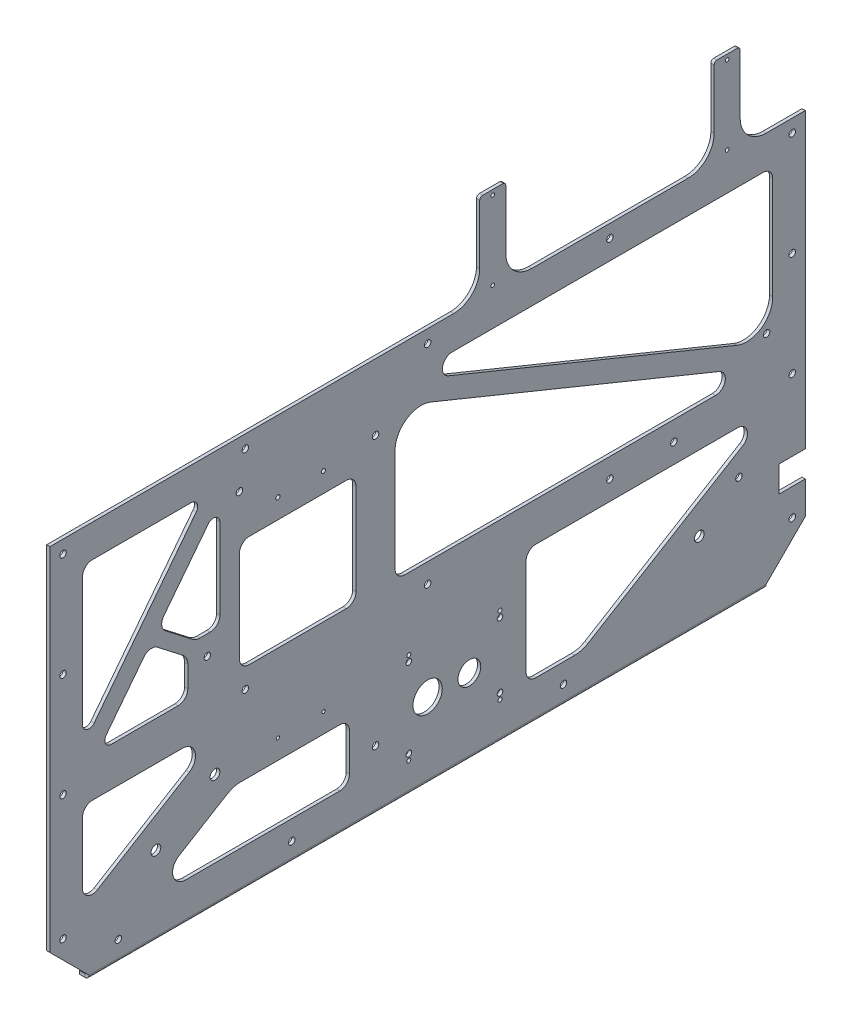
from build123d import *

# Parameters (mm, degrees)
BASE_FLANGE1_DEPTH = 3.175
SKETCH11_W         = 25.4
SKETCH11_H         = 85.725
TAB1_DEPTH         = 3.175
SKETCH6_R          = 4.7625
SKETCH6_R_2        = 14.2875
SKETCH6_R_3        = 3.175
CUT_EXTRUDE1_DEPTH = 595.54789231
SKETCH7_R          = 3.175
SKETCH7_R_2        = 2.032
SKETCH7_R_3        = 1.5875
SKETCH7_R_4        = 1.7859375
SKETCH7_W          = 25.4
SKETCH7_H          = 25.4
CUT_EXTRUDE2_DEPTH = 595.54789231
SKETCH8_R          = 2.726079357
SKETCH8_R_2        = 11.1125
SKETCH8_R_3        = 1.951379357
CUT_EXTRUDE3_DEPTH = 595.54789231
SKETCH9_R          = 4.7625
CUT_EXTRUDE4_DEPTH = 595.54789231
SKETCH10_R         = 3.175
CUT_EXTRUDE5_DEPTH = 595.54789231
FILLET2_R          = 2.794
FILLET3_R          = 25.4
CUT_EXTRUDE6_DEPTH = 595.54789231
CUT_EXTRUDE7_DEPTH = 595.54789231
EDGE_FLANGE1_DEPTH = 660.4


# Sheet-metal steps are written as plain solids
with BuildPart() as part:
    # Sketch1 → Base-Flange1 (new body)
    with BuildSketch(Plane(origin=(0, 0, 0), x_dir=(0, 0, -1), z_dir=(1, 0, 0))):
        Polygon((330.2, 0), (-330.2, 0), (-368.3, 38.1), (-368.3, 381), (368.3, 381), (368.3, 38.1), align=None)
    extrude(amount=-BASE_FLANGE1_DEPTH)

    # Sketch11 → Tab1 (add)
    with BuildSketch(Plane(origin=(0, 0, 0), x_dir=(0, 0, -1), z_dir=(1, 0, 0))):
        with Locations((292.1, 423.8625)):
            Rectangle(SKETCH11_W, SKETCH11_H)
        with Locations((63.5, 423.8625)):
            Rectangle(SKETCH11_W, SKETCH11_H)
    extrude(amount=-TAB1_DEPTH)

    # Sketch6 → Cut-Extrude1 (cut, through all)
    with BuildSketch(Plane(origin=(0, 0, 0), x_dir=(0, 0, -1), z_dir=(1, 0, 0))):
        with Locations((264.979179141, 73.025)):
            Circle(SKETCH6_R)
        with Locations((0, 69.85)):
            Circle(SKETCH6_R_2)
        with Locations((-264.979179141, 73.025)):
            Circle(SKETCH6_R)
        with Locations((132.489589571, 14.2875)):
            Circle(SKETCH6_R_3)
        with Locations((-132.489589571, 14.2875)):
            Circle(SKETCH6_R_3)
    extrude(amount=-CUT_EXTRUDE1_DEPTH, mode=Mode.SUBTRACT)

    # Sketch7 → Cut-Extrude2 (cut, through all)
    with BuildSketch(Plane(origin=(0, 0, 0), x_dir=(0, 0, -1), z_dir=(1, 0, 0))):
        with Locations((-355.6, 43.360512242)):
            Circle(SKETCH7_R)
        with Locations((-355.6, 165.1)):
            Circle(SKETCH7_R)
        with Locations((-177.8, 165.1)):
            Circle(SKETCH7_R)
        with Locations((0, 165.1)):
            Circle(SKETCH7_R)
        with Locations((177.8, 165.1)):
            Circle(SKETCH7_R)
        with Locations((355.6, 43.360512242)):
            Circle(SKETCH7_R)
        with Locations((355.6, 165.1)):
            Circle(SKETCH7_R)
        with Locations((-214.833393668, 211.619209216)):
            Circle(SKETCH7_R)
        with Locations((-301.625, 15.875)):
            Circle(SKETCH7_R)
        with Locations((-146.05, 311.4675)):
            Circle(SKETCH7_R_2)
        with Locations((-101.6, 311.4675)):
            Circle(SKETCH7_R_2)
        with Locations((303.625, 103.575)):
            Circle(SKETCH7_R)
        with Locations((-101.6, 108.2675)):
            Circle(SKETCH7_R_3)
        with Locations((-146.05, 108.2675)):
            Circle(SKETCH7_R_3)
        with Locations((240.125, 165.10000014)):
            Circle(SKETCH7_R)
        with Locations((330.6125, 211.525)):
            Circle(SKETCH7_R)
        with Locations((-355.6, 368.3)):
            Circle(SKETCH7_R)
        with Locations((-177.8, 368.3)):
            Circle(SKETCH7_R)
        with Locations((0, 368.3)):
            Circle(SKETCH7_R)
        with Locations((177.8, 368.3)):
            Circle(SKETCH7_R)
        with Locations((355.6, 368.3)):
            Circle(SKETCH7_R)
        with Locations((-50.8, 316.23)):
            Circle(SKETCH7_R)
        with Locations((-50.8, 53.975)):
            Circle(SKETCH7_R)
        with Locations((-355.6, 266.7)):
            Circle(SKETCH7_R)
        with Locations((355.6, 266.7)):
            Circle(SKETCH7_R)
        with Locations((63.5, 461.9625)):
            Circle(SKETCH7_R_4)
        with Locations((63.5, 385.7625)):
            Circle(SKETCH7_R_4)
        with Locations((292.1, 461.9625)):
            Circle(SKETCH7_R_4)
        with Locations((292.1, 385.7625)):
            Circle(SKETCH7_R_4)
        with Locations((355.6, 82.55)):
            Rectangle(SKETCH7_W, SKETCH7_H)
    extrude(amount=-CUT_EXTRUDE2_DEPTH, mode=Mode.SUBTRACT)

    # Sketch8 → Cut-Extrude3 (cut, through all)
    with BuildSketch(Plane(origin=(0, 0, 0), x_dir=(0, 0, -1), z_dir=(1, 0, 0))):
        with Locations((70.587936913, 38.1)):
            Circle(SKETCH8_R)
        with Locations((-18.312063087, 108.585)):
            Circle(SKETCH8_R)
        with Locations((-18.312063087, 31.115)):
            Circle(SKETCH8_R)
        with Locations((40.7162, 69.85)):
            Circle(SKETCH8_R_2)
        with Locations((70.587936913, 101.6)):
            Circle(SKETCH8_R)
        with Locations((70.587936913, 107.442)):
            Circle(SKETCH8_R_3)
        with Locations((70.587936913, 32.258)):
            Circle(SKETCH8_R_3)
        with Locations((-18.312063087, 25.273)):
            Circle(SKETCH8_R_3)
        with Locations((-18.312063087, 114.427)):
            Circle(SKETCH8_R_3)
    extrude(amount=-CUT_EXTRUDE3_DEPTH, mode=Mode.SUBTRACT)

    # Sketch9 → Cut-Extrude4 (cut, through all)
    with BuildSketch(Plane(origin=(0, 0, 0), x_dir=(0, 0, -1), z_dir=(1, 0, 0))):
        with Locations((-207.346876043, 108.0375157)):
            Circle(SKETCH9_R)
    extrude(amount=-CUT_EXTRUDE4_DEPTH, mode=Mode.SUBTRACT)

    # Sketch10 → Cut-Extrude5 (cut, through all)
    with BuildSketch(Plane(origin=(0, 0, 0), x_dir=(0, 0, -1), z_dir=(1, 0, 0))):
        with Locations((-183.534376043, 335.0500157)):
            Circle(SKETCH10_R)
    extrude(amount=-CUT_EXTRUDE5_DEPTH, mode=Mode.SUBTRACT)

    # Fillet2
    fillet2_edges = [part.edges().sort_by_distance(p)[0] for p in [
        (-1.5875, 466.725, -279.4),
        (-1.5875, 466.725, -304.8),
        (-1.5875, 466.725, -76.2),
        (-1.5875, 466.725, -50.8),
    ]]
    fillet(fillet2_edges, radius=FILLET2_R)

    # Fillet3
    fillet3_edges = [part.edges().sort_by_distance(p)[0] for p in [
        (-1.5875, 381, -304.8),
        (-1.5875, 381, -279.4),
        (-1.5875, 381, -76.2),
        (-1.5875, 381, -50.8),
    ]]
    fillet(fillet3_edges, radius=FILLET3_R)

    # Sketch12 → Cut-Extrude6 (cut, through all)
    with BuildSketch(Plane(origin=(0, 0, 0), x_dir=(0, 0, -1), z_dir=(1, 0, 0))):
        with BuildLine():
            Line((23.970213308, 349.25), (327.025, 349.25))
            ThreePointArc((327.025, 349.25), (333.760192091, 346.460192091), (336.55, 339.725))
            Line((336.55, 339.725), (336.55, 239.595215184))
            ThreePointArc((336.55, 239.595215184), (325.31415787, 218.511177814), (301.547115604, 216.080440865))
            Line((301.547115604, 216.080440865), (20.36913166, 330.90695963))
            ThreePointArc((20.36913166, 330.90695963), (14.623624103, 341.559910145), (23.970213308, 349.25))
        make_face()
        with BuildLine():
            Line((-79.375, 292.4175), (-174.009376043, 292.4175))
            ThreePointArc((-174.009376043, 292.4175), (-180.744568134, 289.627692091), (-183.534376043, 282.8925))
            Line((-183.534376043, 282.8925), (-183.534376043, 193.675))
            ThreePointArc((-183.534376043, 193.675), (-180.744568134, 186.939807909), (-174.009376043, 184.15))
            Line((-174.009376043, 184.15), (-79.375, 184.15))
            ThreePointArc((-79.375, 184.15), (-72.639807909, 186.939807909), (-69.85, 193.675))
            Line((-69.85, 193.675), (-69.85, 282.8925))
            ThreePointArc((-69.85, 282.8925), (-72.639807909, 289.627692091), (-79.375, 292.4175))
        make_face()
        with BuildLine():
            Line((280.829786692, 184.15), (-22.225, 184.15))
            ThreePointArc((-22.225, 184.15), (-28.960192091, 186.939807909), (-31.75, 193.675))
            Line((-31.75, 193.675), (-31.75, 293.804784816))
            ThreePointArc((-31.75, 293.804784816), (-20.51415787, 314.888822186), (3.252884396, 317.319559135))
            Line((3.252884396, 317.319559135), (284.43086834, 202.49304037))
            ThreePointArc((284.43086834, 202.49304037), (290.176375897, 191.840089855), (280.829786692, 184.15))
        make_face()
        with BuildLine():
            Line((-325.18085693, 210.489381593), (-225.577634519, 339.010179587))
            ThreePointArc((-225.577634519, 339.010179587), (-224.89489809, 345.694829188), (-230.596777589, 349.25))
            Line((-230.596777589, 349.25), (-327.025, 349.25))
            ThreePointArc((-327.025, 349.25), (-333.760192091, 346.460192091), (-336.55, 339.725))
            Line((-336.55, 339.725), (-336.55, 214.379202006))
            ThreePointArc((-336.55, 214.379202006), (-332.255594988, 208.371121676), (-325.18085693, 210.489381593))
        make_face()
        with BuildLine():
            Line((-213.953519113, 322.910618407), (-257.340010878, 266.927825794))
            ThreePointArc((-257.340010878, 266.927825794), (-259.260679011, 259.895267612), (-255.646026892, 253.56438057))
            Line((-255.646026892, 253.56438057), (-229.538235995, 233.330923076))
            ThreePointArc((-229.538235995, 233.330923076), (-225.869785145, 231.353048556), (-221.758595169, 230.669209216))
            Line((-221.758595169, 230.669209216), (-212.109376043, 230.669209216))
            ThreePointArc((-212.109376043, 230.669209216), (-205.374183952, 233.459017125), (-202.584376043, 240.194209216))
            Line((-202.584376043, 240.194209216), (-202.584376043, 319.020797994))
            ThreePointArc((-202.584376043, 319.020797994), (-206.878781055, 325.028878324), (-213.953519113, 322.910618407))
        make_face()
        with BuildLine():
            Line((-233.883393668, 214.405900134), (-233.883393668, 193.675))
            ThreePointArc((-233.883393668, 193.675), (-236.673201577, 186.939807909), (-243.408393668, 184.15))
            Line((-243.408393668, 184.15), (-308.537598454, 184.15))
            ThreePointArc((-308.537598454, 184.15), (-314.239477952, 187.705170812), (-313.556741524, 194.389820413))
            Line((-313.556741524, 194.389820413), (-276.789112942, 241.832110445))
            ThreePointArc((-276.789112942, 241.832110445), (-270.4582259, 245.446762564), (-263.425667718, 243.526094431))
            Line((-263.425667718, 243.526094431), (-238.803752842, 224.444186274))
            ThreePointArc((-238.803752842, 224.444186274), (-235.179634672, 219.99555851), (-233.883393668, 214.405900134))
        make_face()
    extrude(amount=-CUT_EXTRUDE6_DEPTH, mode=Mode.SUBTRACT)

    # Sketch13 → Cut-Extrude7 (cut, through all)
    with BuildSketch(Plane(origin=(0, 0, 0), x_dir=(0, 0, -1), z_dir=(1, 0, 0))):
        with BuildLine():
            Line((95.987936913, 136.525), (95.987936913, 42.8625))
            ThreePointArc((95.987936913, 42.8625), (98.777744823, 36.127307909), (105.512936913, 33.3375))
            Line((105.512936913, 33.3375), (143.295855515, 33.3375))
            ThreePointArc((143.295855515, 33.3375), (150.12485752, 34.272734895), (156.450968109, 37.009568376))
            Line((156.450968109, 37.009568376), (307.360042429, 128.377025641))
            ThreePointArc((307.360042429, 128.377025641), (311.60116212, 139.085875752), (302.426875206, 146.05))
            Line((302.426875206, 146.05), (105.512936913, 146.05))
            ThreePointArc((105.512936913, 146.05), (98.777744823, 143.260192091), (95.987936913, 136.525))
        make_face()
        with BuildLine():
            Line((-85.725, 33.3375), (-236.021315694, 33.3375))
            ThreePointArc((-236.021315694, 33.3375), (-248.25111307, 42.613751156), (-242.6152928, 56.891506906))
            Line((-242.6152928, 56.891506906), (-195.48232529, 85.525513813))
            ThreePointArc((-195.48232529, 85.525513813), (-189.141868765, 88.277094752), (-182.294371078, 89.2175))
            Line((-182.294371078, 89.2175), (-85.725, 89.2175))
            ThreePointArc((-85.725, 89.2175), (-78.989807909, 86.427692091), (-76.2, 79.6925))
            Line((-76.2, 79.6925), (-76.2, 42.8625))
            ThreePointArc((-76.2, 42.8625), (-78.989807909, 36.127307909), (-85.725, 33.3375))
        make_face()
        with BuildLine():
            Line((-232.467919662, 122.495993094), (-322.07951717, 68.055561322))
            ThreePointArc((-322.07951717, 68.055561322), (-331.695112474, 67.894519991), (-336.55, 76.196066502))
            Line((-336.55, 76.196066502), (-336.55, 136.525))
            ThreePointArc((-336.55, 136.525), (-333.760192091, 143.260192091), (-327.025, 146.05))
            Line((-327.025, 146.05), (-239.061896769, 146.05))
            ThreePointArc((-239.061896769, 146.05), (-226.832099393, 136.773748844), (-232.467919662, 122.495993094))
        make_face()
    extrude(amount=-CUT_EXTRUDE7_DEPTH, mode=Mode.SUBTRACT)

    # Edge-Flange1 section (across the edge) → Edge-Flange1 (add)
    with BuildSketch(Plane(origin=(-3.175, -0.7366, -330.2), x_dir=(0, 1, 0), z_dir=(0, 0, 1))):
        with BuildLine():
            Line((-3.175, 0.7366), (-3.175, 6.35))
            Line((-3.175, 6.35), (0, 6.35))
            Line((0, 6.35), (0, 0.7366))
            ThreePointArc((0, 0.7366), (0.215745145, 0.215745145), (0.7366, 0))
            Line((0.7366, 0), (0.7366, -3.175))
            ThreePointArc((0.7366, -3.175), (-2.029318885, -2.029318885), (-3.175, 0.7366))
        make_face()
    extrude(amount=EDGE_FLANGE1_DEPTH)


solid = part.part
